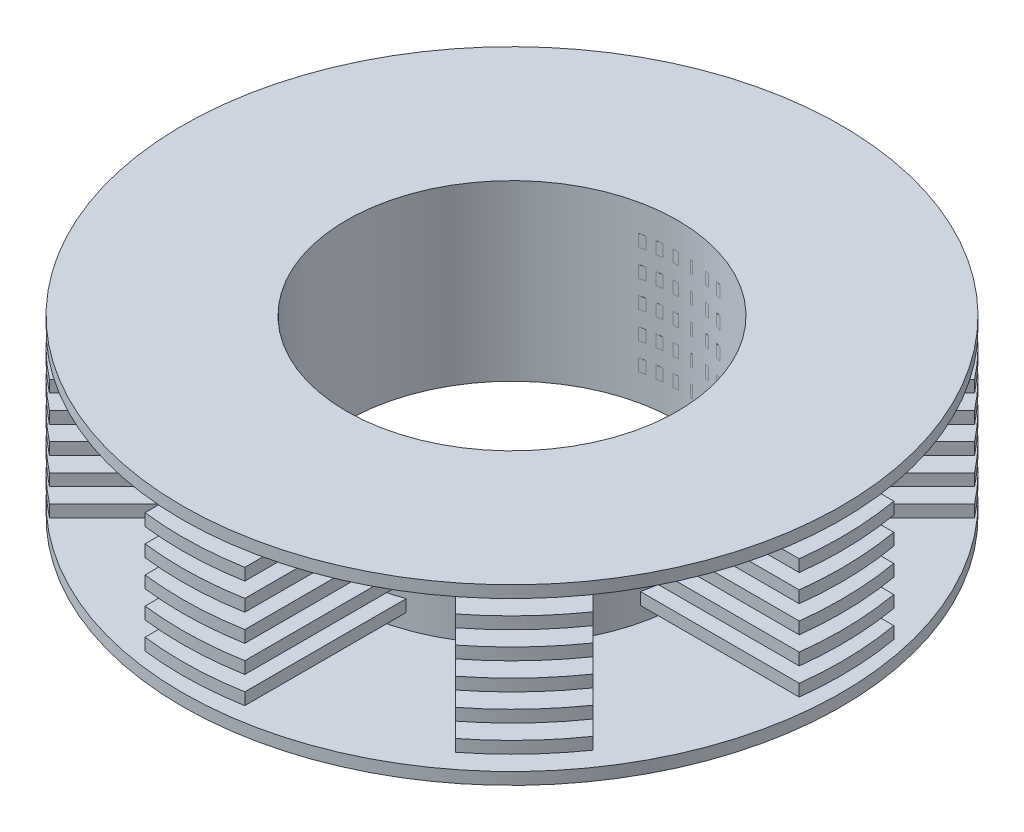
from build123d import *

# Parameters (mm, degrees)
SKETCH1_R                = 22
SKETCH1_R_2              = 11.05
BOSS_EXTRUDE1_DEPTH      = 0.8
BOSS_EXTRUDE2_START      = 10.8
SKETCH1_3_R              = 11.55
SKETCH1_3_R_2            = 11.05
BOSS_EXTRUDE2_DEPTH      = 10.8
BOSS_EXTRUDE7_START      = -11.55
SKETCH8_W                = 6.487351232
SKETCH8_H                = 0.8
BOSS_EXTRUDE7_DEPTH      = 24
BOSS_EXTRUDE7_2_DEPTH    = 24
BOSS_EXTRUDE7_3_DEPTH    = 24
BOSS_EXTRUDE7_4_DEPTH    = 24
BOSS_EXTRUDE7_5_DEPTH    = 24
BOSS_EXTRUDE7_6_DEPTH    = 24
BOSS_EXTRUDE14_START     = 10.8
SKETCH1_15_R             = 22
SKETCH1_15_R_2           = 11.55
BOSS_EXTRUDE14_DEPTH     = 0.8
CUT_EXTRUDE13_DEPTH      = 35.302186519
CUT_EXTRUDE13_DEPTH_BACK = 35.302186519
SKETCH1_16_R             = 11.05
CUT_EXTRUDE14_DEPTH      = 35.302186519
CUT_EXTRUDE14_DEPTH_BACK = 35.302186519
SKETCH1_17_R             = 30
SKETCH1_17_R_2           = 22
CIRPATTERN1_START        = 1
CIRPATTERN1_DEPTH        = 0.8
CIRPATTERN1_START_2      = 2.8
CIRPATTERN1_2_DEPTH      = 0.8
CIRPATTERN1_START_3      = 4.6
CIRPATTERN1_3_DEPTH      = 0.8
CIRPATTERN1_START_4      = 6.4
CIRPATTERN1_4_DEPTH      = 0.8
CIRPATTERN1_START_5      = 8.2
CIRPATTERN1_5_DEPTH      = 0.8


# Read off the part's stored shape, not the designer's step: CirPattern1
with BuildPart() as part:
    # Sketch1 → Boss-Extrude1 (new body)
    with BuildSketch(Plane(origin=(0, 0, 0), x_dir=(1, 0, 0), z_dir=(0, 1, 0))):
        with Locations(Location((0, 0, 0), (0, 0, 270))):
            Circle(SKETCH1_R)
        with Locations(Location((0, 0, 0), (0, 0, 270))):
            Circle(SKETCH1_R_2, mode=Mode.SUBTRACT)
    extrude(amount=-BOSS_EXTRUDE1_DEPTH)

    # Sketch1<3> → Boss-Extrude2 (add)
    with BuildSketch(Plane(origin=(0, 0, 0), x_dir=(1, 0, 0), z_dir=(0, 1, 0)).offset(BOSS_EXTRUDE2_START)):
        with Locations(Location((0, 0, 0), (0, 0, 90))):
            Circle(SKETCH1_3_R)
        with Locations(Location((0, 0, 0), (0, 0, 270))):
            Circle(SKETCH1_3_R_2, mode=Mode.SUBTRACT)
    extrude(amount=-BOSS_EXTRUDE2_DEPTH)



with BuildPart() as body_2:
    # Sketch8 → Boss-Extrude7 (new, symmetric)
    with BuildSketch(Plane(origin=(0, 10.8, 11.55), x_dir=(1, 0, 0), z_dir=(0, 0, 1)).offset(BOSS_EXTRUDE7_START)):
        with Locations((0.581948129, -9.4)):
            Rectangle(SKETCH8_W, SKETCH8_H)
    extrude(amount=BOSS_EXTRUDE7_DEPTH, both=True)


with BuildPart() as body_3:
    # Sketch8 → Boss-Extrude7 2 (new, symmetric)
    with BuildSketch(Plane(origin=(0, 10.8, 11.55), x_dir=(1, 0, 0), z_dir=(0, 0, 1)).offset(BOSS_EXTRUDE7_START)):
        with Locations((0.581948129, -7.6)):
            Rectangle(SKETCH8_W, SKETCH8_H)
    extrude(amount=BOSS_EXTRUDE7_2_DEPTH, both=True)


with BuildPart() as body_4:
    # Sketch8 → Boss-Extrude7 3 (new, symmetric)
    with BuildSketch(Plane(origin=(0, 10.8, 11.55), x_dir=(1, 0, 0), z_dir=(0, 0, 1)).offset(BOSS_EXTRUDE7_START)):
        with Locations((0.581948129, -5.8)):
            Rectangle(SKETCH8_W, SKETCH8_H)
    extrude(amount=BOSS_EXTRUDE7_3_DEPTH, both=True)


with BuildPart() as body_5:
    # Sketch8 → Boss-Extrude7 4 (new, symmetric)
    with BuildSketch(Plane(origin=(0, 10.8, 11.55), x_dir=(1, 0, 0), z_dir=(0, 0, 1)).offset(BOSS_EXTRUDE7_START)):
        with Locations((0.581948129, -4)):
            Rectangle(SKETCH8_W, SKETCH8_H)
    extrude(amount=BOSS_EXTRUDE7_4_DEPTH, both=True)


with BuildPart() as body_6:
    # Sketch8 → Boss-Extrude7 5 (new, symmetric)
    with BuildSketch(Plane(origin=(0, 10.8, 11.55), x_dir=(1, 0, 0), z_dir=(0, 0, 1)).offset(BOSS_EXTRUDE7_START)):
        with Locations((0.581948129, -2.2)):
            Rectangle(SKETCH8_W, SKETCH8_H)
    extrude(amount=BOSS_EXTRUDE7_5_DEPTH, both=True)


with BuildPart() as body_7:
    # Sketch8 → Boss-Extrude7 6 (new, symmetric)
    with BuildSketch(Plane(origin=(0, 10.8, 11.55), x_dir=(1, 0, 0), z_dir=(0, 0, 1)).offset(BOSS_EXTRUDE7_START)):
        with Locations((0.581948129, -0.4)):
            Rectangle(SKETCH8_W, SKETCH8_H)
    extrude(amount=BOSS_EXTRUDE7_6_DEPTH, both=True)


with BuildPart() as part_1:
    add(part.part)

    add(body_7.part)  # Boss-Extrude14 merges body 7
    # Sketch1<15> → Boss-Extrude14 (add)
    with BuildSketch(Plane(origin=(0, 0, 0), x_dir=(1, 0, 0), z_dir=(0, 1, 0)).offset(BOSS_EXTRUDE14_START)):
        with Locations(Location((0, 0, 0), (0, 0, 270))):
            Circle(SKETCH1_15_R)
        with Locations(Location((0, 0, 0), (0, 0, 90))):
            Circle(SKETCH1_15_R_2, mode=Mode.SUBTRACT)
    extrude(amount=-BOSS_EXTRUDE14_DEPTH)


with BuildPart() as cut_extrude13_tool:
    # Sketch1<16> → Cut-Extrude13 (new, two sides: drawn at the far end of the back side and taken through both)
    with BuildSketch(Plane(origin=(0, 0, 0), x_dir=(1, 0, 0), z_dir=(0, 1, 0)).offset(-CUT_EXTRUDE13_DEPTH_BACK)):
        with Locations(Location((0, 0, 0), (0, 0, 270))):
            Circle(SKETCH1_16_R)
    extrude(amount=CUT_EXTRUDE13_DEPTH + CUT_EXTRUDE13_DEPTH_BACK)


with BuildPart() as part_2:
    add(part_1.part)

    # Cut-Extrude13: cut by cut_extrude13_tool
    add(cut_extrude13_tool.part, mode=Mode.SUBTRACT)


with BuildPart() as body_2_1:
    add(body_2.part)

    # Cut-Extrude13: cut by cut_extrude13_tool
    add(cut_extrude13_tool.part, mode=Mode.SUBTRACT)


with BuildPart() as body_3_1:
    add(body_3.part)

    # Cut-Extrude13: cut by cut_extrude13_tool
    add(cut_extrude13_tool.part, mode=Mode.SUBTRACT)


with BuildPart() as body_4_1:
    add(body_4.part)

    # Cut-Extrude13: cut by cut_extrude13_tool
    add(cut_extrude13_tool.part, mode=Mode.SUBTRACT)


with BuildPart() as body_5_1:
    add(body_5.part)

    # Cut-Extrude13: cut by cut_extrude13_tool
    add(cut_extrude13_tool.part, mode=Mode.SUBTRACT)


with BuildPart() as body_6_1:
    add(body_6.part)

    # Cut-Extrude13: cut by cut_extrude13_tool
    add(cut_extrude13_tool.part, mode=Mode.SUBTRACT)


with BuildPart() as cut_extrude14_tool:
    # Sketch1<17> → Cut-Extrude14 (new, two sides: drawn at the far end of the back side and taken through both)
    with BuildSketch(Plane(origin=(0, 0, 0), x_dir=(1, 0, 0), z_dir=(0, 1, 0)).offset(-CUT_EXTRUDE14_DEPTH_BACK)):
        Circle(SKETCH1_17_R)
        with Locations(Location((0, 0, 0), (0, 0, 270))):
            Circle(SKETCH1_17_R_2, mode=Mode.SUBTRACT)
    extrude(amount=CUT_EXTRUDE14_DEPTH + CUT_EXTRUDE14_DEPTH_BACK)


with BuildPart() as part_3:
    add(part_2.part)

    # Cut-Extrude14: cut by cut_extrude14_tool
    add(cut_extrude14_tool.part, mode=Mode.SUBTRACT)

    # CirPattern1 outline → CirPattern1 (add)
    with BuildSketch(Plane(origin=(0, 0, 0), x_dir=(1, 0, 0), z_dir=(0, 1, 0)).offset(CIRPATTERN1_START)):
        with BuildLine():
            Line((6.0651289, -9.829380012), (13.559946954, -17.324198066))
            ThreePointArc((13.559946954, -17.324198066), (15.966834366, -15.134734895), (18.024468521, -12.614219537))
            Line((18.024468521, -12.614219537), (10.411196869, -5.000947885))
            ThreePointArc((10.411196869, -5.000947885), (8.584623866, -7.727013206), (6.0651289, -9.829380012))
        make_face()
        with BuildLine():
            Line((-13.559946954, -17.324198066), (-6.0651289, -9.829380012))
            ThreePointArc((-6.0651289, -9.829380012), (-8.584623866, -7.727013206), (-10.411196869, -5.000947885))
            Line((-10.411196869, -5.000947885), (-18.024468521, -12.614219537))
            ThreePointArc((-18.024468521, -12.614219537), (-15.966834366, -15.134734895), (-13.559946954, -17.324198066))
        make_face()
        with BuildLine():
            ThreePointArc((10.898032068, 3.825623745), (11.534069186, 0.606422314), (11.239115036, -2.661727487))
            Line((11.239115036, -2.661727487), (21.838388374, -2.661727487))
            ThreePointArc((21.838388374, -2.661727487), (21.99213053, 0.588383179), (21.664824093, 3.825623745))
            Line((21.664824093, 3.825623745), (10.898032068, 3.825623745))
        make_face()
        with BuildLine():
            Line((-21.838388374, -2.661727487), (-11.239115036, -2.661727487))
            ThreePointArc((-11.239115036, -2.661727487), (-11.534069186, 0.606422314), (-10.898032068, 3.825623745))
            Line((-10.898032068, 3.825623745), (-21.664824093, 3.825623745))
            ThreePointArc((-21.664824093, 3.825623745), (-21.99213053, 0.588383179), (-21.838388374, -2.661727487))
        make_face()
        with BuildLine():
            ThreePointArc((5.000947885, 10.411196869), (7.727013206, 8.584623866), (9.829380012, 6.0651289))
            Line((9.829380012, 6.0651289), (17.324198066, 13.559946954))
            ThreePointArc((17.324198066, 13.559946954), (15.134734895, 15.966834366), (12.614219537, 18.024468521))
            Line((12.614219537, 18.024468521), (5.000947885, 10.411196869))
        make_face()
        with BuildLine():
            Line((-17.324198066, 13.559946954), (-9.829380012, 6.0651289))
            ThreePointArc((-9.829380012, 6.0651289), (-7.727013206, 8.584623866), (-5.000947885, 10.411196869))
            Line((-5.000947885, 10.411196869), (-12.614219537, 18.024468521))
            ThreePointArc((-12.614219537, 18.024468521), (-15.134734895, 15.966834366), (-17.324198066, 13.559946954))
        make_face()
    extrude(amount=CIRPATTERN1_DEPTH)

    # CirPattern1 2 outline → CirPattern1 2 (add)
    with BuildSketch(Plane(origin=(0, 0, 0), x_dir=(1, 0, 0), z_dir=(0, 1, 0)).offset(CIRPATTERN1_START_2)):
        with BuildLine():
            Line((6.0651289, -9.829380012), (13.559946954, -17.324198066))
            ThreePointArc((13.559946954, -17.324198066), (15.966834366, -15.134734895), (18.024468521, -12.614219537))
            Line((18.024468521, -12.614219537), (10.411196869, -5.000947885))
            ThreePointArc((10.411196869, -5.000947885), (8.584623866, -7.727013206), (6.0651289, -9.829380012))
        make_face()
        with BuildLine():
            Line((-13.559946954, -17.324198066), (-6.0651289, -9.829380012))
            ThreePointArc((-6.0651289, -9.829380012), (-8.584623866, -7.727013206), (-10.411196869, -5.000947885))
            Line((-10.411196869, -5.000947885), (-18.024468521, -12.614219537))
            ThreePointArc((-18.024468521, -12.614219537), (-15.966834366, -15.134734895), (-13.559946954, -17.324198066))
        make_face()
        with BuildLine():
            ThreePointArc((10.898032068, 3.825623745), (11.534069186, 0.606422314), (11.239115036, -2.661727487))
            Line((11.239115036, -2.661727487), (21.838388374, -2.661727487))
            ThreePointArc((21.838388374, -2.661727487), (21.99213053, 0.588383179), (21.664824093, 3.825623745))
            Line((21.664824093, 3.825623745), (10.898032068, 3.825623745))
        make_face()
        with BuildLine():
            Line((-21.838388374, -2.661727487), (-11.239115036, -2.661727487))
            ThreePointArc((-11.239115036, -2.661727487), (-11.534069186, 0.606422314), (-10.898032068, 3.825623745))
            Line((-10.898032068, 3.825623745), (-21.664824093, 3.825623745))
            ThreePointArc((-21.664824093, 3.825623745), (-21.99213053, 0.588383179), (-21.838388374, -2.661727487))
        make_face()
        with BuildLine():
            ThreePointArc((5.000947885, 10.411196869), (7.727013206, 8.584623866), (9.829380012, 6.0651289))
            Line((9.829380012, 6.0651289), (17.324198066, 13.559946954))
            ThreePointArc((17.324198066, 13.559946954), (15.134734895, 15.966834366), (12.614219537, 18.024468521))
            Line((12.614219537, 18.024468521), (5.000947885, 10.411196869))
        make_face()
        with BuildLine():
            Line((-17.324198066, 13.559946954), (-9.829380012, 6.0651289))
            ThreePointArc((-9.829380012, 6.0651289), (-7.727013206, 8.584623866), (-5.000947885, 10.411196869))
            Line((-5.000947885, 10.411196869), (-12.614219537, 18.024468521))
            ThreePointArc((-12.614219537, 18.024468521), (-15.134734895, 15.966834366), (-17.324198066, 13.559946954))
        make_face()
    extrude(amount=CIRPATTERN1_2_DEPTH)

    # CirPattern1 3 outline → CirPattern1 3 (add)
    with BuildSketch(Plane(origin=(0, 0, 0), x_dir=(1, 0, 0), z_dir=(0, 1, 0)).offset(CIRPATTERN1_START_3)):
        with BuildLine():
            Line((6.0651289, -9.829380012), (13.559946954, -17.324198066))
            ThreePointArc((13.559946954, -17.324198066), (15.966834366, -15.134734895), (18.024468521, -12.614219537))
            Line((18.024468521, -12.614219537), (10.411196869, -5.000947885))
            ThreePointArc((10.411196869, -5.000947885), (8.584623866, -7.727013206), (6.0651289, -9.829380012))
        make_face()
        with BuildLine():
            Line((-13.559946954, -17.324198066), (-6.0651289, -9.829380012))
            ThreePointArc((-6.0651289, -9.829380012), (-8.584623866, -7.727013206), (-10.411196869, -5.000947885))
            Line((-10.411196869, -5.000947885), (-18.024468521, -12.614219537))
            ThreePointArc((-18.024468521, -12.614219537), (-15.966834366, -15.134734895), (-13.559946954, -17.324198066))
        make_face()
        with BuildLine():
            ThreePointArc((10.898032068, 3.825623745), (11.534069186, 0.606422314), (11.239115036, -2.661727487))
            Line((11.239115036, -2.661727487), (21.838388374, -2.661727487))
            ThreePointArc((21.838388374, -2.661727487), (21.99213053, 0.588383179), (21.664824093, 3.825623745))
            Line((21.664824093, 3.825623745), (10.898032068, 3.825623745))
        make_face()
        with BuildLine():
            Line((-21.838388374, -2.661727487), (-11.239115036, -2.661727487))
            ThreePointArc((-11.239115036, -2.661727487), (-11.534069186, 0.606422314), (-10.898032068, 3.825623745))
            Line((-10.898032068, 3.825623745), (-21.664824093, 3.825623745))
            ThreePointArc((-21.664824093, 3.825623745), (-21.99213053, 0.588383179), (-21.838388374, -2.661727487))
        make_face()
        with BuildLine():
            ThreePointArc((5.000947885, 10.411196869), (7.727013206, 8.584623866), (9.829380012, 6.0651289))
            Line((9.829380012, 6.0651289), (17.324198066, 13.559946954))
            ThreePointArc((17.324198066, 13.559946954), (15.134734895, 15.966834366), (12.614219537, 18.024468521))
            Line((12.614219537, 18.024468521), (5.000947885, 10.411196869))
        make_face()
        with BuildLine():
            Line((-17.324198066, 13.559946954), (-9.829380012, 6.0651289))
            ThreePointArc((-9.829380012, 6.0651289), (-7.727013206, 8.584623866), (-5.000947885, 10.411196869))
            Line((-5.000947885, 10.411196869), (-12.614219537, 18.024468521))
            ThreePointArc((-12.614219537, 18.024468521), (-15.134734895, 15.966834366), (-17.324198066, 13.559946954))
        make_face()
    extrude(amount=CIRPATTERN1_3_DEPTH)

    # CirPattern1 4 outline → CirPattern1 4 (add)
    with BuildSketch(Plane(origin=(0, 0, 0), x_dir=(1, 0, 0), z_dir=(0, 1, 0)).offset(CIRPATTERN1_START_4)):
        with BuildLine():
            Line((6.0651289, -9.829380012), (13.559946954, -17.324198066))
            ThreePointArc((13.559946954, -17.324198066), (15.966834366, -15.134734895), (18.024468521, -12.614219537))
            Line((18.024468521, -12.614219537), (10.411196869, -5.000947885))
            ThreePointArc((10.411196869, -5.000947885), (8.584623866, -7.727013206), (6.0651289, -9.829380012))
        make_face()
        with BuildLine():
            Line((-13.559946954, -17.324198066), (-6.0651289, -9.829380012))
            ThreePointArc((-6.0651289, -9.829380012), (-8.584623866, -7.727013206), (-10.411196869, -5.000947885))
            Line((-10.411196869, -5.000947885), (-18.024468521, -12.614219537))
            ThreePointArc((-18.024468521, -12.614219537), (-15.966834366, -15.134734895), (-13.559946954, -17.324198066))
        make_face()
        with BuildLine():
            ThreePointArc((10.898032068, 3.825623745), (11.534069186, 0.606422314), (11.239115036, -2.661727487))
            Line((11.239115036, -2.661727487), (21.838388374, -2.661727487))
            ThreePointArc((21.838388374, -2.661727487), (21.99213053, 0.588383179), (21.664824093, 3.825623745))
            Line((21.664824093, 3.825623745), (10.898032068, 3.825623745))
        make_face()
        with BuildLine():
            Line((-21.838388374, -2.661727487), (-11.239115036, -2.661727487))
            ThreePointArc((-11.239115036, -2.661727487), (-11.534069186, 0.606422314), (-10.898032068, 3.825623745))
            Line((-10.898032068, 3.825623745), (-21.664824093, 3.825623745))
            ThreePointArc((-21.664824093, 3.825623745), (-21.99213053, 0.588383179), (-21.838388374, -2.661727487))
        make_face()
        with BuildLine():
            ThreePointArc((5.000947885, 10.411196869), (7.727013206, 8.584623866), (9.829380012, 6.0651289))
            Line((9.829380012, 6.0651289), (17.324198066, 13.559946954))
            ThreePointArc((17.324198066, 13.559946954), (15.134734895, 15.966834366), (12.614219537, 18.024468521))
            Line((12.614219537, 18.024468521), (5.000947885, 10.411196869))
        make_face()
        with BuildLine():
            Line((-17.324198066, 13.559946954), (-9.829380012, 6.0651289))
            ThreePointArc((-9.829380012, 6.0651289), (-7.727013206, 8.584623866), (-5.000947885, 10.411196869))
            Line((-5.000947885, 10.411196869), (-12.614219537, 18.024468521))
            ThreePointArc((-12.614219537, 18.024468521), (-15.134734895, 15.966834366), (-17.324198066, 13.559946954))
        make_face()
    extrude(amount=CIRPATTERN1_4_DEPTH)

    # CirPattern1 5 outline → CirPattern1 5 (add)
    with BuildSketch(Plane(origin=(0, 0, 0), x_dir=(1, 0, 0), z_dir=(0, 1, 0)).offset(CIRPATTERN1_START_5)):
        with BuildLine():
            Line((6.0651289, -9.829380012), (13.559946954, -17.324198066))
            ThreePointArc((13.559946954, -17.324198066), (15.966834366, -15.134734895), (18.024468521, -12.614219537))
            Line((18.024468521, -12.614219537), (10.411196869, -5.000947885))
            ThreePointArc((10.411196869, -5.000947885), (8.584623866, -7.727013206), (6.0651289, -9.829380012))
        make_face()
        with BuildLine():
            Line((-13.559946954, -17.324198066), (-6.0651289, -9.829380012))
            ThreePointArc((-6.0651289, -9.829380012), (-8.584623866, -7.727013206), (-10.411196869, -5.000947885))
            Line((-10.411196869, -5.000947885), (-18.024468521, -12.614219537))
            ThreePointArc((-18.024468521, -12.614219537), (-15.966834366, -15.134734895), (-13.559946954, -17.324198066))
        make_face()
        with BuildLine():
            ThreePointArc((10.898032068, 3.825623745), (11.534069186, 0.606422314), (11.239115036, -2.661727487))
            Line((11.239115036, -2.661727487), (21.838388374, -2.661727487))
            ThreePointArc((21.838388374, -2.661727487), (21.99213053, 0.588383179), (21.664824093, 3.825623745))
            Line((21.664824093, 3.825623745), (10.898032068, 3.825623745))
        make_face()
        with BuildLine():
            Line((-21.838388374, -2.661727487), (-11.239115036, -2.661727487))
            ThreePointArc((-11.239115036, -2.661727487), (-11.534069186, 0.606422314), (-10.898032068, 3.825623745))
            Line((-10.898032068, 3.825623745), (-21.664824093, 3.825623745))
            ThreePointArc((-21.664824093, 3.825623745), (-21.99213053, 0.588383179), (-21.838388374, -2.661727487))
        make_face()
        with BuildLine():
            ThreePointArc((5.000947885, 10.411196869), (7.727013206, 8.584623866), (9.829380012, 6.0651289))
            Line((9.829380012, 6.0651289), (17.324198066, 13.559946954))
            ThreePointArc((17.324198066, 13.559946954), (15.134734895, 15.966834366), (12.614219537, 18.024468521))
            Line((12.614219537, 18.024468521), (5.000947885, 10.411196869))
        make_face()
        with BuildLine():
            Line((-17.324198066, 13.559946954), (-9.829380012, 6.0651289))
            ThreePointArc((-9.829380012, 6.0651289), (-7.727013206, 8.584623866), (-5.000947885, 10.411196869))
            Line((-5.000947885, 10.411196869), (-12.614219537, 18.024468521))
            ThreePointArc((-12.614219537, 18.024468521), (-15.134734895, 15.966834366), (-17.324198066, 13.559946954))
        make_face()
    extrude(amount=CIRPATTERN1_5_DEPTH)


with BuildPart() as body_2_2:
    add(body_2_1.part)

    # Cut-Extrude14: cut by cut_extrude14_tool
    add(cut_extrude14_tool.part, mode=Mode.SUBTRACT)


with BuildPart() as body_3_2:
    add(body_3_1.part)

    # Cut-Extrude14: cut by cut_extrude14_tool
    add(cut_extrude14_tool.part, mode=Mode.SUBTRACT)


with BuildPart() as body_4_2:
    add(body_4_1.part)

    # Cut-Extrude14: cut by cut_extrude14_tool
    add(cut_extrude14_tool.part, mode=Mode.SUBTRACT)


with BuildPart() as body_5_2:
    add(body_5_1.part)

    # Cut-Extrude14: cut by cut_extrude14_tool
    add(cut_extrude14_tool.part, mode=Mode.SUBTRACT)


with BuildPart() as body_6_2:
    add(body_6_1.part)

    # Cut-Extrude14: cut by cut_extrude14_tool
    add(cut_extrude14_tool.part, mode=Mode.SUBTRACT)


solid = Compound([part_3.part, body_2_2.part, body_3_2.part, body_4_2.part, body_5_2.part, body_6_2.part])
